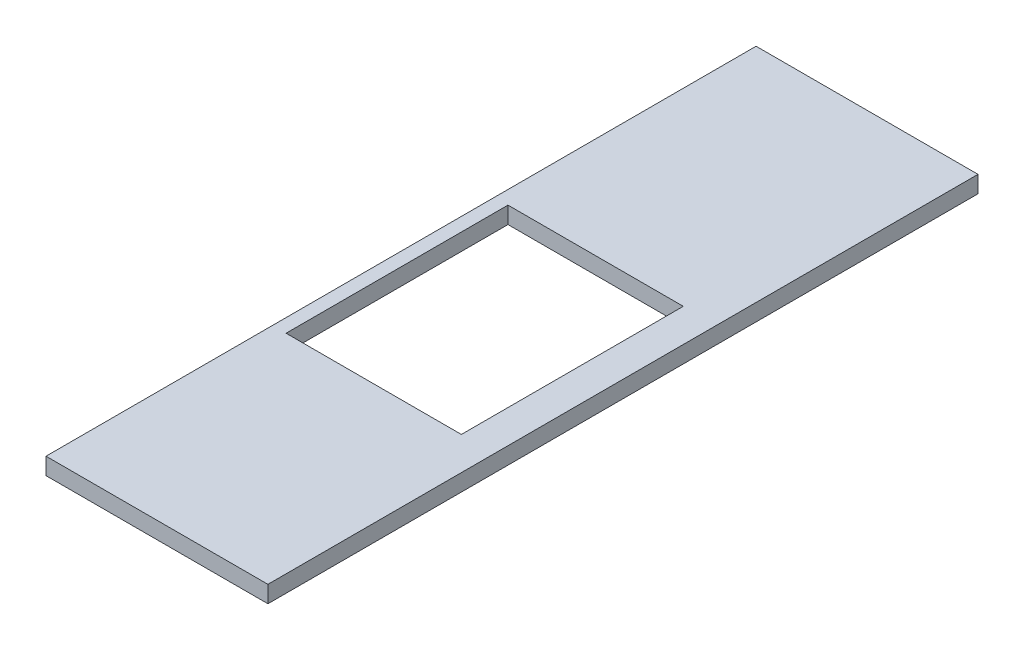
from build123d import *

# Parameters (mm, degrees)
SKETCH_1_W          = 500
SKETCH_1_H          = 1600
EXTRUDE_1_DEPTH     = 38
SKETCH_2_W          = 395
SKETCH_2_H          = 500
CUT_EXTRUDE_1_DEPTH = 1677.736115195


with BuildPart() as part:
    # Эскиз1 → Бобышка-Вытянуть1 (new body)
    with BuildSketch(Plane(origin=(0, 0, 0), x_dir=(1, 0, 0), z_dir=(0, 1, 0))):
        with Locations((250, 800)):
            Rectangle(SKETCH_1_W, SKETCH_1_H)
    extrude(amount=EXTRUDE_1_DEPTH)

    # Эскиз2 → Вырез-Вытянуть1 (cut, through all)
    with BuildSketch(Plane(origin=(0, 38, 0), x_dir=(1, 0, 0), z_dir=(0, 1, 0))):
        with Locations((228.011033581, 760.411289807)):
            Rectangle(SKETCH_2_W, SKETCH_2_H)
    extrude(amount=-CUT_EXTRUDE_1_DEPTH, mode=Mode.SUBTRACT)


solid = part.part
